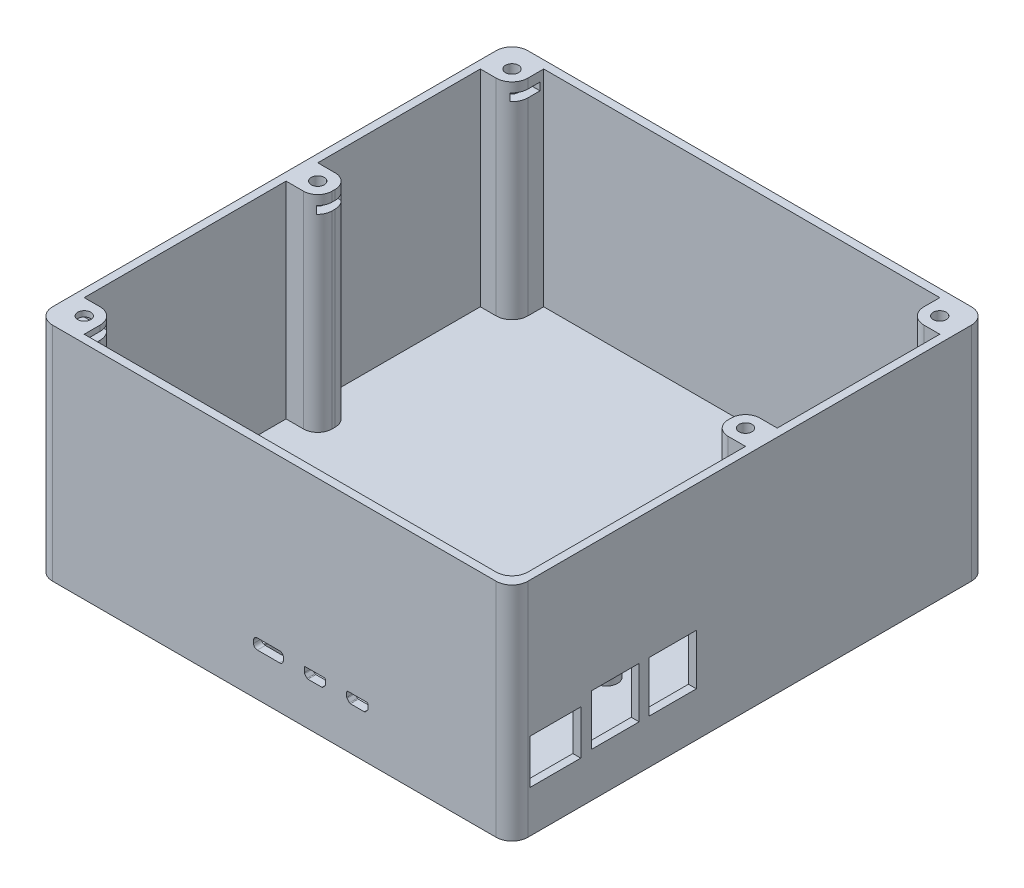
from build123d import *

# Parameters (mm, degrees)
CROQUIS2_W              = 150
CROQUIS2_H              = 150
SALIENTE_EXTRUIR1_DEPTH = 70
CROQUIS3_W              = 145
CROQUIS3_H              = 145
CORTAR_EXTRUIR1_DEPTH   = 65
CROQUIS4_R              = 3.5
SALIENTE_EXTRUIR3_DEPTH = 7
CROQUIS5_R              = 1.4
CORTAR_EXTRUIR2_DEPTH   = 6
CORTAR_EXTRUIR3_REACH   = 183.728
CROQUIS7_W              = 16
CROQUIS7_H              = 14
CROQUIS7_W_2            = 15
CROQUIS7_H_2            = 16
CORTAR_EXTRUIR4_REACH   = 183.728
SALIENTE_EXTRUIR4_DEPTH = 65
CROQUIS10_R             = 2.05
CORTAR_EXTRUIR5_DEPTH   = 15
CROQUIS11_W             = 7.7
CROQUIS11_H             = 2.4
CORTAR_EXTRUIR6_DEPTH   = 10
CROQUIS12_W             = 7.7
CROQUIS12_H             = 2.4
CORTAR_EXTRUIR7_DEPTH   = 10
REDONDEO1_R             = 5
REDONDEO2_R             = 5


with BuildPart() as part:
    # Croquis2 → Saliente-Extruir1 (new body)
    with BuildSketch(Plane(origin=(0, 0, 0), x_dir=(1, 0, 0), z_dir=(0, 1, 0))):
        Rectangle(CROQUIS2_W, CROQUIS2_H)
    extrude(amount=SALIENTE_EXTRUIR1_DEPTH)

    # Croquis3 → Cortar-Extruir1 (cut)
    with BuildSketch(Plane(origin=(0, 70, 0), x_dir=(1, 0, 0), z_dir=(0, 1, 0))):
        Rectangle(CROQUIS3_W, CROQUIS3_H)
    extrude(amount=-CORTAR_EXTRUIR1_DEPTH, mode=Mode.SUBTRACT)

    # Croquis4 → Saliente-Extruir3 (add)
    with BuildSketch(Plane(origin=(0, 5, 0), x_dir=(1, 0, 0), z_dir=(0, 1, 0))):
        with Locations(Location((-9.4, -67.8, 0), (0, 0, 90))):
            Circle(CROQUIS4_R)
        with Locations(Location((48.6, -67.8, 0), (0, 0, 90))):
            Circle(CROQUIS4_R)
        with Locations(Location((-9.4, -18.8, 0), (0, 0, 90))):
            Circle(CROQUIS4_R)
        with Locations(Location((48.6, -18.8, 0), (0, 0, 90))):
            Circle(CROQUIS4_R)
    extrude(amount=SALIENTE_EXTRUIR3_DEPTH)

    # Croquis5 → Cortar-Extruir2 (cut)
    with BuildSketch(Plane(origin=(0, 12, 0), x_dir=(1, 0, 0), z_dir=(0, 1, 0))):
        with Locations(Location((-9.4, -18.8, 0), (0, 0, 270))):
            Circle(CROQUIS5_R)
        with Locations(Location((48.6, -18.8, 0), (0, 0, 270))):
            Circle(CROQUIS5_R)
        with Locations(Location((-9.4, -67.8, 0), (0, 0, 270))):
            Circle(CROQUIS5_R)
        with Locations(Location((48.6, -67.8, 0), (0, 0, 270))):
            Circle(CROQUIS5_R)
    extrude(amount=-CORTAR_EXTRUIR2_DEPTH, mode=Mode.SUBTRACT)

    # Croquis7 → Cortar-Extruir3 (cut, up to next)
    with BuildSketch(Plane(origin=(75, 0, 0), x_dir=(0, 0, -1), z_dir=(1, 0, 0)), mode=Mode.PRIVATE) as cortar_extruir3_sk1:
        with Locations((-61.3, 20.3)):
            Rectangle(CROQUIS7_W, CROQUIS7_H)
    cortar_extruir3_tool1 = extrude(cortar_extruir3_sk1.sketch, amount=-CORTAR_EXTRUIR3_REACH, mode=Mode.PRIVATE) & part.part
    # Croquis7 → Cortar-Extruir3 (cut, up to next)
    with BuildSketch(Plane(origin=(75, 0, 0), x_dir=(0, 0, -1), z_dir=(1, 0, 0)), mode=Mode.PRIVATE) as cortar_extruir3_sk2:
        with Locations((-42.365979033, 22)):
            Rectangle(CROQUIS7_W_2, CROQUIS7_H_2)
    cortar_extruir3_tool2 = extrude(cortar_extruir3_sk2.sketch, amount=-CORTAR_EXTRUIR3_REACH, mode=Mode.PRIVATE) & part.part
    # Croquis7 → Cortar-Extruir3 (cut, up to next)
    with BuildSketch(Plane(origin=(75, 0, 0), x_dir=(0, 0, -1), z_dir=(1, 0, 0)), mode=Mode.PRIVATE) as cortar_extruir3_sk3:
        with Locations((-24.315979033, 22)):
            Rectangle(CROQUIS7_W_2, CROQUIS7_H_2)
    cortar_extruir3_tool3 = extrude(cortar_extruir3_sk3.sketch, amount=-CORTAR_EXTRUIR3_REACH, mode=Mode.PRIVATE) & part.part
    add(cortar_extruir3_tool1.solids().sort_by_distance((75, 20.3, 61.3))[0], mode=Mode.SUBTRACT)
    add(cortar_extruir3_tool2.solids().sort_by_distance((75, 22, 42.365979))[0], mode=Mode.SUBTRACT)
    add(cortar_extruir3_tool3.solids().sort_by_distance((75, 22, 24.315979))[0], mode=Mode.SUBTRACT)

    # Croquis8 → Cortar-Extruir4 (cut, up to next)
    with BuildSketch(Plane.XY.offset(75), mode=Mode.PRIVATE) as cortar_extruir4_sk1:
        with BuildLine():
            Line((24.021428571, 13.52), (28.378571429, 13.52))
            ThreePointArc((28.378571429, 13.52), (28.536139148, 13.552341988), (28.668226601, 13.644137931))
            Line((28.668226601, 13.644137931), (29.439655172, 14.454137931))
            ThreePointArc((29.439655172, 14.454137931), (29.521390676, 14.581443729), (29.55, 14.73))
            Line((29.55, 14.73), (29.55, 16.12))
            ThreePointArc((29.55, 16.12), (29.432842712, 16.402842712), (29.15, 16.52))
            Line((29.15, 16.52), (23.25, 16.52))
            ThreePointArc((23.25, 16.52), (22.967157288, 16.402842712), (22.85, 16.12))
            Line((22.85, 16.12), (22.85, 14.73))
            ThreePointArc((22.85, 14.73), (22.878609324, 14.581443729), (22.960344828, 14.454137931))
            Line((22.960344828, 14.454137931), (23.731773399, 13.644137931))
            ThreePointArc((23.731773399, 13.644137931), (23.863860852, 13.552341988), (24.021428571, 13.52))
        make_face()
    cortar_extruir4_tool1 = extrude(cortar_extruir4_sk1.sketch, amount=-CORTAR_EXTRUIR4_REACH, mode=Mode.PRIVATE) & part.part
    # Croquis8 → Cortar-Extruir4 (cut, up to next)
    with BuildSketch(Plane.XY.offset(75), mode=Mode.PRIVATE) as cortar_extruir4_sk2:
        with BuildLine():
            Line((9.560344828, 14.454137931), (10.331773399, 13.644137931))
            ThreePointArc((10.331773399, 13.644137931), (10.463860852, 13.552341988), (10.621428571, 13.52))
            Line((10.621428571, 13.52), (14.978571429, 13.52))
            ThreePointArc((14.978571429, 13.52), (15.136139148, 13.552341988), (15.268226601, 13.644137931))
            Line((15.268226601, 13.644137931), (16.039655172, 14.454137931))
            ThreePointArc((16.039655172, 14.454137931), (16.121390676, 14.581443729), (16.15, 14.73))
            Line((16.15, 14.73), (16.15, 16.12))
            ThreePointArc((16.15, 16.12), (16.032842712, 16.402842712), (15.75, 16.52))
            Line((15.75, 16.52), (9.85, 16.52))
            ThreePointArc((9.85, 16.52), (9.567157288, 16.402842712), (9.45, 16.12))
            Line((9.45, 16.12), (9.45, 14.73))
            ThreePointArc((9.45, 14.73), (9.478609324, 14.581443729), (9.560344828, 14.454137931))
        make_face()
    cortar_extruir4_tool2 = extrude(cortar_extruir4_sk2.sketch, amount=-CORTAR_EXTRUIR4_REACH, mode=Mode.PRIVATE) & part.part
    # Croquis8 → Cortar-Extruir4 (cut, up to next)
    with BuildSketch(Plane.XY.offset(75), mode=Mode.PRIVATE) as cortar_extruir4_sk3:
        with BuildLine():
            Line((-5.35, 13.52), (1.65, 13.52))
            ThreePointArc((1.65, 13.52), (2.498528137, 13.871471863), (2.85, 14.72))
            Line((2.85, 14.72), (2.85, 15.62))
            ThreePointArc((2.85, 15.62), (2.498528137, 16.468528137), (1.65, 16.82))
            Line((1.65, 16.82), (-5.35, 16.82))
            ThreePointArc((-5.35, 16.82), (-6.198528137, 16.468528137), (-6.55, 15.62))
            Line((-6.55, 15.62), (-6.55, 14.72))
            ThreePointArc((-6.55, 14.72), (-6.198528137, 13.871471863), (-5.35, 13.52))
        make_face()
    cortar_extruir4_tool3 = extrude(cortar_extruir4_sk3.sketch, amount=-CORTAR_EXTRUIR4_REACH, mode=Mode.PRIVATE) & part.part
    add(cortar_extruir4_tool1.solids().sort_by_distance((26.2, 15.079288, 75))[0], mode=Mode.SUBTRACT)
    add(cortar_extruir4_tool2.solids().sort_by_distance((12.8, 15.079288, 75))[0], mode=Mode.SUBTRACT)
    add(cortar_extruir4_tool3.solids().sort_by_distance((-1.85, 15.17, 75))[0], mode=Mode.SUBTRACT)

    # Croquis9 → Saliente-Extruir4 (add, through all)
    with BuildSketch(Plane(origin=(0, 5, 0), x_dir=(1, 0, 0), z_dir=(0, 1, 0))):
        with BuildLine():
            Line((-72.5, -72.5), (-62.5, -72.5))
            Line((-62.5, -72.5), (-62.5, -67.5))
            ThreePointArc((-62.5, -67.5), (-63.964466094, -63.964466094), (-67.5, -62.5))
            Line((-67.5, -62.5), (-72.5, -62.5))
            Line((-72.5, -62.5), (-72.5, -72.5))
        make_face()
        with BuildLine():
            Line((-72.5, 72.5), (-62.5, 72.5))
            Line((-62.5, 72.5), (-62.5, 67.5))
            ThreePointArc((-62.5, 67.5), (-63.964466094, 63.964466094), (-67.5, 62.5))
            Line((-67.5, 62.5), (-72.5, 62.5))
            Line((-72.5, 62.5), (-72.5, 72.5))
        make_face()
        with BuildLine():
            Line((72.5, 72.5), (62.5, 72.5))
            Line((62.5, 72.5), (62.5, 67.5))
            ThreePointArc((62.5, 67.5), (63.964466094, 63.964466094), (67.5, 62.5))
            Line((67.5, 62.5), (72.5, 62.5))
            Line((72.5, 62.5), (72.5, 72.5))
        make_face()
        with BuildLine():
            Line((72.5, 1.2), (67, 1.2))
            ThreePointArc((67, 1.2), (63.818019485, 2.518019485), (62.5, 5.7))
            Line((62.5, 5.7), (62.5, 6.7))
            ThreePointArc((62.5, 6.7), (63.818019485, 9.881980515), (67, 11.2))
            Line((67, 11.2), (72.5, 11.2))
            Line((72.5, 11.2), (72.5, 1.2))
        make_face()
        with BuildLine():
            Line((-72.5, 1.2), (-67, 1.2))
            ThreePointArc((-67, 1.2), (-63.818019485, 2.518019485), (-62.5, 5.7))
            Line((-62.5, 5.7), (-62.5, 6.7))
            ThreePointArc((-62.5, 6.7), (-63.818019485, 9.881980515), (-67, 11.2))
            Line((-67, 11.2), (-72.5, 11.2))
            Line((-72.5, 11.2), (-72.5, 1.2))
        make_face()
    extrude(amount=SALIENTE_EXTRUIR4_DEPTH)

    # Croquis10 → Cortar-Extruir5 (cut)
    with BuildSketch(Plane(origin=(0, 70, 0), x_dir=(1, 0, 0), z_dir=(0, 1, 0))):
        with Locations(Location((-67.5, 67.5, 0), (0, 0, 270))):
            Circle(CROQUIS10_R)
        with Locations(Location((-67.5, 6.2, 0), (0, 0, 270))):
            Circle(CROQUIS10_R)
        with Locations(Location((-67.5, -67.5, 0), (0, 0, 270))):
            Circle(CROQUIS10_R)
        with Locations(Location((67.5, 67.5, 0), (0, 0, 270))):
            Circle(CROQUIS10_R)
        with Locations(Location((67.5, 6.2, 0), (0, 0, 270))):
            Circle(CROQUIS10_R)
    extrude(amount=-CORTAR_EXTRUIR5_DEPTH, mode=Mode.SUBTRACT)

    # Croquis11 → Cortar-Extruir6 (cut)
    with BuildSketch(Plane(origin=(-62.5, 0, 0), x_dir=(0, 0, -1), z_dir=(1, 0, 0))):
        with Locations((67.5, 65.8)):
            Rectangle(CROQUIS11_W, CROQUIS11_H)
        with Locations((6.2, 65.8)):
            Rectangle(CROQUIS11_W, CROQUIS11_H)
        with Locations((-67.5, 67.057552177)):
            Rectangle(CROQUIS11_W, CROQUIS11_H)
    extrude(amount=-CORTAR_EXTRUIR6_DEPTH, mode=Mode.SUBTRACT)

    # Croquis12 → Cortar-Extruir7 (cut)
    with BuildSketch(Plane.ZY.offset(-62.5)):
        with Locations((-67.5, 65.8)):
            Rectangle(CROQUIS12_W, CROQUIS12_H)
        with Locations((-6.2, 65.8)):
            Rectangle(CROQUIS12_W, CROQUIS12_H)
    extrude(amount=-CORTAR_EXTRUIR7_DEPTH, mode=Mode.SUBTRACT)

    # Redondeo1
    redondeo1_edges = [part.edges().sort_by_distance(p)[0] for p in [
        (75, 35, 75),
        (-75, 35, 75),
        (-75, 35, -75),
        (75, 35, -75),
    ]]
    fillet(redondeo1_edges, radius=REDONDEO1_R)

    # Redondeo2
    # the kernel refuses this fillet: 5 mm, written as the material it adds along each edge
    with BuildSketch(Plane(origin=(72.5, 70, 72.5), x_dir=(-1, 0, 0), z_dir=(0, -1, 0))) as redondeo2_piece_1_section:
        with BuildLine():
            CenterArc((REDONDEO2_R, REDONDEO2_R), REDONDEO2_R, 180, 90)
            Line((0, REDONDEO2_R), (0, 0))
            Line((0, 0), (REDONDEO2_R, 0))
        make_face()
    redondeo2_piece_1 = extrude(amount=65, mode=Mode.PRIVATE)
    redondeo2_piece_1 = split(redondeo2_piece_1, bisect_by=Plane(origin=(71.298407374, 27.3, 71.540307306), z_dir=(0, 1, 0)), keep=Keep.TOP, mode=Mode.PRIVATE)
    redondeo2_piece_1 = split(redondeo2_piece_1, bisect_by=Plane(origin=(71.298407374, 48.65, 69.3), z_dir=(0, 0, 1)), keep=Keep.TOP, mode=Mode.PRIVATE)
    add(redondeo2_piece_1)
    with BuildSketch(Plane(origin=(72.5, 70, 72.5), x_dir=(-1, 0, 0), z_dir=(0, -1, 0))) as redondeo2_piece_2_section:
        with BuildLine():
            CenterArc((REDONDEO2_R, REDONDEO2_R), REDONDEO2_R, 180, 90)
            Line((0, REDONDEO2_R), (0, 0))
            Line((0, 0), (REDONDEO2_R, 0))
        make_face()
    redondeo2_piece_2 = extrude(amount=65, mode=Mode.PRIVATE)
    redondeo2_piece_2 = split(redondeo2_piece_2, bisect_by=Plane(origin=(72.471377344, 27.3, 68.63753235), z_dir=(0, 1, 0)), keep=Keep.TOP, mode=Mode.PRIVATE)
    redondeo2_piece_2 = split(redondeo2_piece_2, bisect_by=Plane(origin=(72.471377344, 48.65, 69.3), z_dir=(0, 0, -1)), keep=Keep.TOP, mode=Mode.PRIVATE)
    add(redondeo2_piece_2)
    with BuildSketch(Plane(origin=(72.5, 70, 72.5), x_dir=(-1, 0, 0), z_dir=(0, -1, 0))) as redondeo2_piece_3_section:
        with BuildLine():
            CenterArc((REDONDEO2_R, REDONDEO2_R), REDONDEO2_R, 180, 90)
            Line((0, REDONDEO2_R), (0, 0))
            Line((0, 0), (REDONDEO2_R, 0))
        make_face()
    redondeo2_piece_3 = extrude(amount=65, mode=Mode.PRIVATE)
    redondeo2_piece_3 = split(redondeo2_piece_3, bisect_by=Plane(origin=(71.298407374, 27.3, 71.540307306), z_dir=(0, -1, 0)), keep=Keep.TOP, mode=Mode.PRIVATE)
    redondeo2_piece_3 = split(redondeo2_piece_3, bisect_by=Plane(origin=(71.298407374, 13.3, 71.540307306), z_dir=(0, 1, 0)), keep=Keep.TOP, mode=Mode.PRIVATE)
    redondeo2_piece_3 = split(redondeo2_piece_3, bisect_by=Plane(origin=(71.298407374, 20.3, 69.3), z_dir=(0, 0, 1)), keep=Keep.TOP, mode=Mode.PRIVATE)
    add(redondeo2_piece_3)
    with BuildSketch(Plane(origin=(72.5, 70, 72.5), x_dir=(-1, 0, 0), z_dir=(0, -1, 0))) as redondeo2_piece_4_section:
        with BuildLine():
            CenterArc((REDONDEO2_R, REDONDEO2_R), REDONDEO2_R, 180, 90)
            Line((0, REDONDEO2_R), (0, 0))
            Line((0, 0), (REDONDEO2_R, 0))
        make_face()
    redondeo2_piece_4 = extrude(amount=65, mode=Mode.PRIVATE)
    redondeo2_piece_4 = split(redondeo2_piece_4, bisect_by=Plane(origin=(71.298407374, 13.3, 71.540307306), z_dir=(0, -1, 0)), keep=Keep.TOP, mode=Mode.PRIVATE)
    redondeo2_piece_4 = split(redondeo2_piece_4, bisect_by=Plane(origin=(71.298407374, 9.15, 69.3), z_dir=(0, 0, 1)), keep=Keep.TOP, mode=Mode.PRIVATE)
    add(redondeo2_piece_4)
    with BuildSketch(Plane(origin=(72.5, 70, 72.5), x_dir=(-1, 0, 0), z_dir=(0, -1, 0))) as redondeo2_piece_5_section:
        with BuildLine():
            CenterArc((REDONDEO2_R, REDONDEO2_R), REDONDEO2_R, 180, 90)
            Line((0, REDONDEO2_R), (0, 0))
            Line((0, 0), (REDONDEO2_R, 0))
        make_face()
    redondeo2_piece_5 = extrude(amount=65, mode=Mode.PRIVATE)
    redondeo2_piece_5 = split(redondeo2_piece_5, bisect_by=Plane(origin=(72.471377344, 13.3, 68.63753235), z_dir=(0, -1, 0)), keep=Keep.TOP, mode=Mode.PRIVATE)
    redondeo2_piece_5 = split(redondeo2_piece_5, bisect_by=Plane(origin=(72.471377344, 9.15, 69.3), z_dir=(0, 0, -1)), keep=Keep.TOP, mode=Mode.PRIVATE)
    add(redondeo2_piece_5)


solid = part.part
